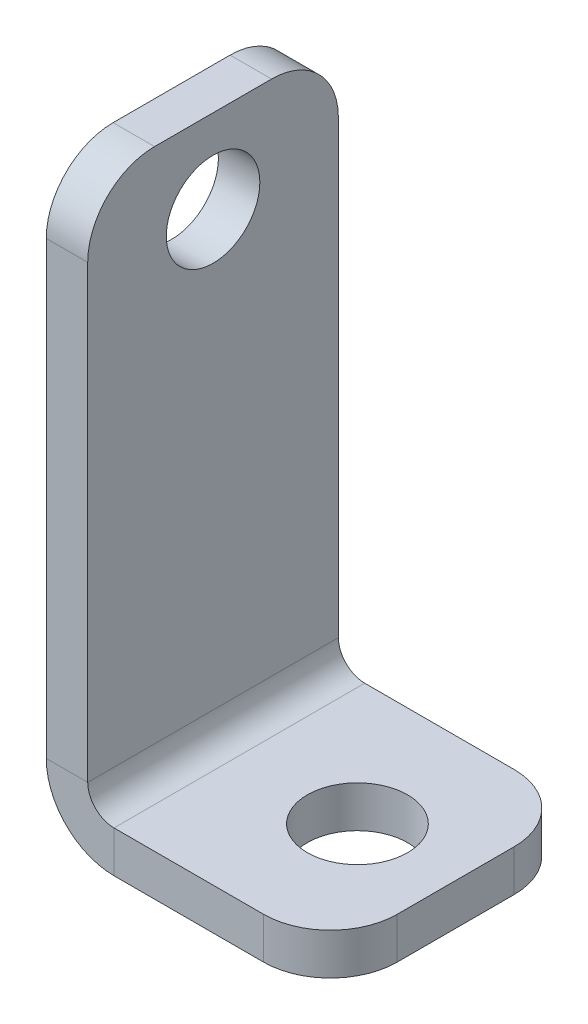
from build123d import *

# Parameters (mm, degrees)
BASE_FLANGE1_DEPTH = 9.525
SKETCH6_R          = 1.905
CUT_EXTRUDE1_DEPTH = 26.173168455
SKETCH7_R          = 1.778
CUT_EXTRUDE2_DEPTH = 26.878337235
FILLET1_R          = 2.54


# Sheet-metal steps are written as plain solids
with BuildPart() as part:
    # Sketch2 → Base-Flange1 (new body)
    with BuildSketch(Plane.XY):
        with BuildLine():
            Line((0, 22.225), (0, 2.5748))
            ThreePointArc((0, 2.5748), (0.75414146, 0.75414146), (2.5748, 0))
            Line((2.5748, 0), (10.795, 0))
            Line((10.795, 0), (10.795, 1.5748))
            Line((10.795, 1.5748), (2.5748, 1.5748))
            ThreePointArc((2.5748, 1.5748), (1.867693219, 1.867693219), (1.5748, 2.5748))
            Line((1.5748, 2.5748), (1.5748, 22.225))
            Line((1.5748, 22.225), (0, 22.225))
        make_face()
    extrude(amount=BASE_FLANGE1_DEPTH)

    # Sketch6 → Cut-Extrude1 (cut, through all)
    with BuildSketch(Plane(origin=(0, 1.5748, 0), x_dir=(1, 0, 0), z_dir=(0, 1, 0))):
        with Locations(Location((7.0612, -4.7625, 0), (0, 0, 270))):
            Circle(SKETCH6_R)
    extrude(amount=-CUT_EXTRUDE1_DEPTH, mode=Mode.SUBTRACT)

    # Sketch7 → Cut-Extrude2 (cut, through all)
    with BuildSketch(Plane(origin=(1.5748, 0, 0), x_dir=(0, 0, -1), z_dir=(1, 0, 0))):
        with Locations((-4.7625, 19.05)):
            Circle(SKETCH7_R)
    extrude(amount=-CUT_EXTRUDE2_DEPTH, mode=Mode.SUBTRACT)

    # Fillet1
    fillet1_edges = [part.edges().sort_by_distance(p)[0] for p in [
        (10.795, 0.7874, 9.525),
        (0.7874, 22.225, 9.525),
        (10.795, 0.7874, 0),
        (0.7874, 22.225, 0),
    ]]
    fillet(fillet1_edges, radius=FILLET1_R)


solid = part.part
